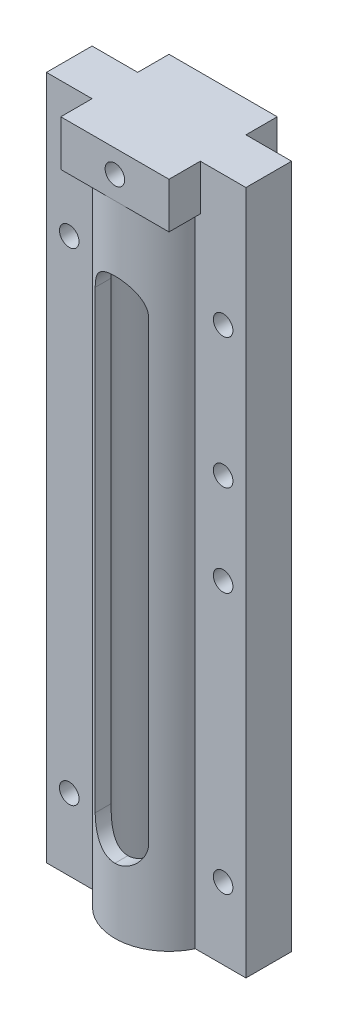
from build123d import *

# Parameters (mm, degrees)
SKETCH1_R                = 8.3
SKETCH1_R_2              = 6.3
BOSS_EXTRUDE1_DEPTH      = 95
SKETCH3_R                = 8.3
BOSS_EXTRUDE2_DEPTH      = 3
SKETCH5_W                = 16.6
SKETCH5_H                = 16.6
BOSS_EXTRUDE4_DEPTH      = 7
CUT_EXTRUDE1_DEPTH       = 107.627623063
FILLET1_R                = 4.1
SKETCH4_R                = 6.3
SKETCH4_R_2              = 1.5
CUT_EXTRUDE3_DEPTH       = 3
BOSS_EXTRUDE6_START      = 2
SKETCH8_R                = 1.5
BOSS_EXTRUDE6_DEPTH      = 2
BOSS_EXTRUDE7_START      = -0.774045
BOSS_EXTRUDE7_DEPTH      = 7.774045
F_3_0_3_DIAMETER_HOLE1_D = 3
F_3_0_3_DIAMETER_HOLE2_D = 3
F_3_0_3_DIAMETER_HOLE3_D = 3


with BuildPart() as part:
    # Sketch1 → Boss-Extrude1 (new body)
    with BuildSketch(Plane(origin=(0, 0, 0), x_dir=(1, 0, 0), z_dir=(0, 1, 0))):
        with Locations(Location((0, 0, 0), (0, 0, 270))):
            Circle(SKETCH1_R)
        with Locations(Location((0, 0, 0), (0, 0, 270))):
            Circle(SKETCH1_R_2, mode=Mode.SUBTRACT)
    extrude(amount=BOSS_EXTRUDE1_DEPTH)

    # Sketch3 → Boss-Extrude2 (add)
    with BuildSketch(Plane(origin=(0, 95, 0), x_dir=(1, 0, 0), z_dir=(0, 1, 0))):
        with Locations(Location((0, 0, 0), (0, 0, 270))):
            Circle(SKETCH3_R)
    extrude(amount=BOSS_EXTRUDE2_DEPTH)

    # Sketch5 → Boss-Extrude4 (add)
    with BuildSketch(Plane(origin=(0, 98, 0), x_dir=(1, 0, 0), z_dir=(0, 1, 0))):
        Rectangle(SKETCH5_W, SKETCH5_H)
    extrude(amount=BOSS_EXTRUDE4_DEPTH)

    # Sketch6 → Cut-Extrude1 (cut, through all)
    with BuildSketch(Plane.XY.offset(8.3)):
        Polygon((4.1, 10), (0, 10), (-4.1, 10), (-4.1, 88), (4.1, 88), align=None)
    extrude(amount=-CUT_EXTRUDE1_DEPTH, mode=Mode.SUBTRACT)

    # Fillet1
    fillet1_edges = [part.edges().sort_by_distance(p)[0] for p in [
        (4.1, 88, 5.999975859),
        (4.1, 88, -5.999975859),
        (-4.1, 88, 5.999975859),
        (-4.1, 88, -5.999975859),
        (4.1, 10, -5.999975859),
        (4.1, 10, 5.999975859),
        (-4.1, 10, -5.999975859),
        (-4.1, 10, 5.999975859),
    ]]
    fillet(fillet1_edges, radius=FILLET1_R - 0.0001)  # a hair under: the kernel refuses the full size

    # Sketch4 → Cut-Extrude3 (cut)
    with BuildSketch(Plane(origin=(0, 95, 0), x_dir=(-1, 0, 0), z_dir=(0, -1, 0))):
        with Locations(Location((0, 0, 0), (0, 0, 90))):
            Circle(SKETCH4_R)
        with Locations(Location((0, 0, 0), (0, 0, 90))):
            Circle(SKETCH4_R_2, mode=Mode.SUBTRACT)
    extrude(amount=-CUT_EXTRUDE3_DEPTH, mode=Mode.SUBTRACT)

    # Sketch8 → Boss-Extrude6 (add)
    with BuildSketch(Plane(origin=(0, 95, 0), x_dir=(-1, 0, 0), z_dir=(0, -1, 0)).offset(BOSS_EXTRUDE6_START)):
        with Locations(Location((0, 0, 0), (0, 0, 90))):
            Circle(SKETCH8_R)
    extrude(amount=-BOSS_EXTRUDE6_DEPTH)

    # Sketch9 → Boss-Extrude7 (add)
    with BuildSketch(Plane.ZY.offset(8.3).offset(BOSS_EXTRUDE7_START)):
        Polygon((0, 0), (3.5, 0), (3.5, 105), (-3.5, 105), (-3.5, 0), align=None)
    boss_extrude7 = extrude(amount=BOSS_EXTRUDE7_DEPTH)

    # Mirror1: Boss-Extrude7 across plane
    add(boss_extrude7.mirror(Plane(origin=(0, 0, 0), x_dir=(0, 0, 1), z_dir=(1, 0, 0))))

    # Ø3.0 (3) Diameter Hole1 (through all)
    with Locations(Plane.XY.offset(8.3)):
        with Locations((0, 101.5)):
            Hole(F_3_0_3_DIAMETER_HOLE1_D / 2)

    # Ø3.0 (3) Diameter Hole2 (through all)
    with Locations(Plane.XY.offset(3.5)):
        with Locations((11.8, 85), (11.8, 11)):
            f_3_0_3_diameter_hole2 = Hole(F_3_0_3_DIAMETER_HOLE2_D / 2)

    # Ø3.0 (3) Diameter Hole3 (through all)
    with Locations(Plane(origin=(0, 0, -3.5), x_dir=(-1, 0, 0), z_dir=(0, 0, -1))):
        with Locations((-11.8, 65), (-11.8, 51)):
            Hole(F_3_0_3_DIAMETER_HOLE3_D / 2)

    # Mirror2: Ø3.0 (3) Diameter Hole2 across plane
    add(f_3_0_3_diameter_hole2.mirror(Plane(origin=(0, 0, 0), x_dir=(0, 0, 1), z_dir=(1, 0, 0))), mode=Mode.SUBTRACT)


solid = part.part
